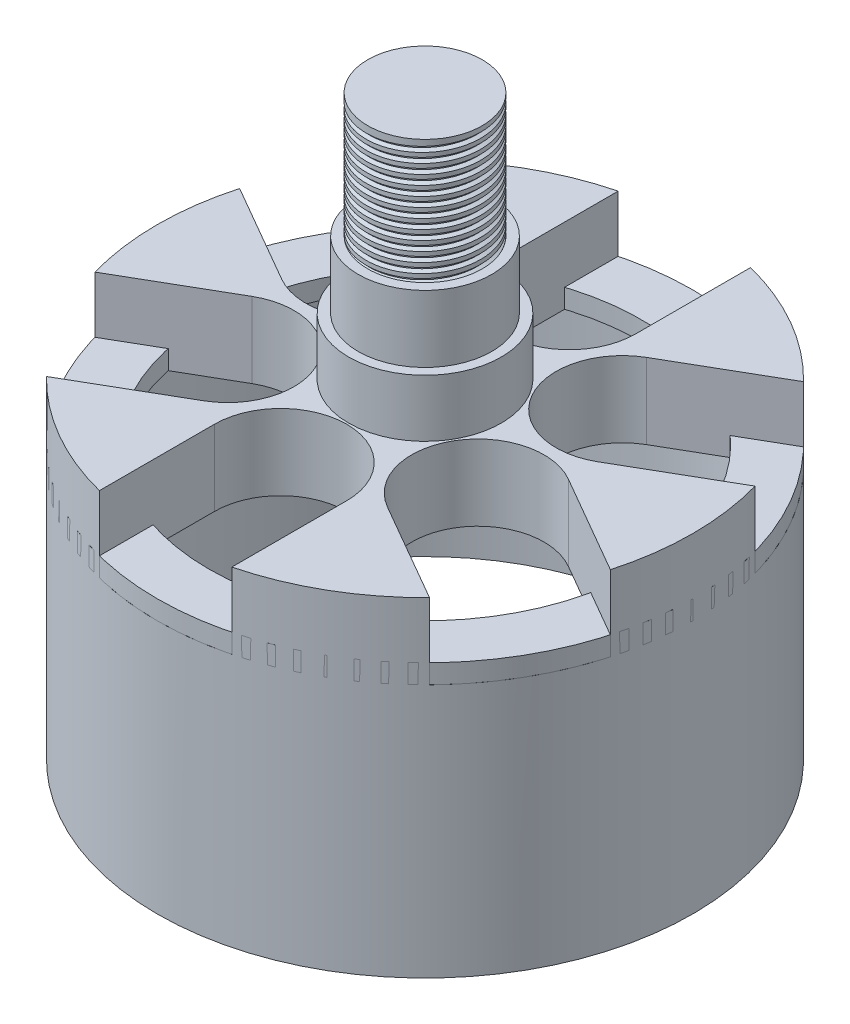
from build123d import *

# Parameters (mm, degrees)
SKETCH1_R           = 14.03
BOSS_EXTRUDE1_DEPTH = 17.27
SKETCH1_3_R         = 13.03
CUT_EXTRUDE1_DEPTH  = 13.31
CUT_EXTRUDE2_START  = -3.96
CUT_EXTRUDE2_DEPTH  = 3.96
SKETCH2_3_R         = 4
BOSS_EXTRUDE2_DEPTH = 3
SKETCH3_R           = 3.5
BOSS_EXTRUDE3_DEPTH = 3.5
SKETCH4_R           = 3
BOSS_EXTRUDE4_DEPTH = 6.5
SKETCH5_R           = 14.03
SKETCH5_R_2         = 11.33
BOSS_EXTRUDE5_DEPTH = 1
THREAD1_PITCH       = 0.5


with BuildPart() as part:
    # Sketch1 → Boss-Extrude1 (new body)
    with BuildSketch(Plane(origin=(0, 0, 0), x_dir=(1, 0, 0), z_dir=(0, 1, 0))):
        with Locations(Location((0, 0, 0), (0, 0, 270))):
            Circle(SKETCH1_R)
    extrude(amount=BOSS_EXTRUDE1_DEPTH)

    # Sketch1<3> → Cut-Extrude1 (cut)
    with BuildSketch(Plane(origin=(0, 0, 0), x_dir=(1, 0, 0), z_dir=(0, 1, 0))):
        with Locations(Location((0, 0, 0), (0, 0, 90))):
            Circle(SKETCH1_3_R)
    extrude(amount=CUT_EXTRUDE1_DEPTH, mode=Mode.SUBTRACT)

    # Sketch2 → Cut-Extrude2 (cut)
    with BuildSketch(Plane(origin=(0, 17.27, 0), x_dir=(1, 0, 0), z_dir=(0, 1, 0)).offset(CUT_EXTRUDE2_START)):
        with BuildLine():
            Line((3.47, -7.57), (3.47, -13.594116374))
            ThreePointArc((3.47, -13.594116374), (0, -14.03), (-3.47, -13.594116374))
            Line((-3.47, -13.594116374), (-3.47, -7.57))
            ThreePointArc((-3.47, -7.57), (0, -4.1), (3.47, -7.57))
        make_face()
        with BuildLine():
            Line((-8.290812307, -0.779891849), (-13.507850122, -3.791950036))
            ThreePointArc((-13.507850122, -3.791950036), (-12.150336415, -7.015), (-10.037850122, -9.802166338))
            Line((-10.037850122, -9.802166338), (-4.820812307, -6.790108151))
            ThreePointArc((-4.820812307, -6.790108151), (-3.550704156, -2.05), (-8.290812307, -0.779891849))
        make_face()
        with BuildLine():
            Line((-4.820812307, 6.790108151), (-10.037850122, 9.802166338))
            ThreePointArc((-10.037850122, 9.802166338), (-12.150336415, 7.015), (-13.507850122, 3.791950036))
            Line((-13.507850122, 3.791950036), (-8.290812307, 0.779891849))
            ThreePointArc((-8.290812307, 0.779891849), (-3.550704156, 2.05), (-4.820812307, 6.790108151))
        make_face()
        with BuildLine():
            Line((3.47, 7.57), (3.47, 13.594116374))
            ThreePointArc((3.47, 13.594116374), (0, 14.03), (-3.47, 13.594116374))
            Line((-3.47, 13.594116374), (-3.47, 7.57))
            ThreePointArc((-3.47, 7.57), (0, 4.1), (3.47, 7.57))
        make_face()
        with BuildLine():
            Line((8.290812307, 0.779891849), (13.507850122, 3.791950036))
            ThreePointArc((13.507850122, 3.791950036), (12.150336415, 7.015), (10.037850122, 9.802166338))
            Line((10.037850122, 9.802166338), (4.820812307, 6.790108151))
            ThreePointArc((4.820812307, 6.790108151), (3.550704156, 2.05), (8.290812307, 0.779891849))
        make_face()
        with BuildLine():
            Line((4.820812307, -6.790108151), (10.037850122, -9.802166338))
            ThreePointArc((10.037850122, -9.802166338), (12.150336415, -7.015), (13.507850122, -3.791950036))
            Line((13.507850122, -3.791950036), (8.290812307, -0.779891849))
            ThreePointArc((8.290812307, -0.779891849), (3.550704156, -2.05), (4.820812307, -6.790108151))
        make_face()
    extrude(amount=CUT_EXTRUDE2_DEPTH, mode=Mode.SUBTRACT)

    # Sketch2<3> → Boss-Extrude2 (add)
    with BuildSketch(Plane(origin=(0, 17.27, 0), x_dir=(1, 0, 0), z_dir=(0, 1, 0))):
        with Locations(Location((0, 0, 0), (0, 0, 270))):
            Circle(SKETCH2_3_R)
    extrude(amount=BOSS_EXTRUDE2_DEPTH)

    # Sketch3 → Boss-Extrude3 (add)
    with BuildSketch(Plane(origin=(0, 20.27, 0), x_dir=(1, 0, 0), z_dir=(0, 1, 0))):
        with Locations(Location((0, 0, 0), (0, 0, 270))):
            Circle(SKETCH3_R)
    extrude(amount=BOSS_EXTRUDE3_DEPTH)

    # Sketch4 → Boss-Extrude4 (add)
    with BuildSketch(Plane(origin=(0, 23.77, 0), x_dir=(1, 0, 0), z_dir=(0, 1, 0))):
        with Locations(Location((0, 0, 0), (0, 0, 90))):
            Circle(SKETCH4_R)
    extrude(amount=BOSS_EXTRUDE4_DEPTH)

    # Thread1: the profile of Thread Profile1 profile screwed along a right-hand helix of 13 turns, 6 arcs to a turn; built about Z, then put on its axis
    thread1_z = Axis((0, 0, 0), (0, 0, 1))
    thread1_corners = [(3.0003, 0, -0.000173205), (3.0003, 0, 0.277985704), (2.828148085, 0, 0.17859375), (2.828148085, 0, 0.09921875)]
    with BuildLine(mode=Mode.PRIVATE) as thread1_profile:
        Line(thread1_corners[0], thread1_corners[1])
        Line(thread1_corners[1], thread1_corners[2])
        Line(thread1_corners[2], thread1_corners[3])
        Line(thread1_corners[3], thread1_corners[0])
    thread1_cap = Face(thread1_profile.wire())
    thread1_turn_angles = [0, 30, 60, 90, 120, 150, 180, 210, 240, 270, 300, 330, 360]
    thread1_turn_weights = [1, 0.8660254037844387, 1, 0.8660254037844387, 1, 0.8660254037844387, 1, 0.8660254037844387, 1, 0.8660254037844387, 1, 0.8660254037844387, 1]
    thread1_turn_rails = [Edge.make_bspline([Vector(p[0], p[1], 0).rotate(thread1_z, thread1_turn_angles[k]) / thread1_turn_weights[k] + Vector(0, 0, p[2] + THREAD1_PITCH * thread1_turn_angles[k] / 360) for k in range(13)], [0, 0, 0, 1, 1, 2, 2, 3, 3, 4, 4, 5, 5, 6, 6, 6], 2, thread1_turn_weights) for p in thread1_corners]
    thread1_turn_sides = [Face.make_surface_from_curves(thread1_turn_rails[p[0]], thread1_turn_rails[p[1]]) for p in [(0, 1), (1, 2), (2, 3), (3, 0)]]
    thread1 = Plane(origin=(0, 30.27, 0), x_dir=(-1, 0, 0), z_dir=(0, -1, 0)) * Solid(Shell([*[p.moved(Location((0, 0, THREAD1_PITCH * i))) for i in range(13) for p in thread1_turn_sides], thread1_cap, thread1_cap.rotate(thread1_z, 4680).moved(Location((0, 0, THREAD1_PITCH * 4680 / 360)))]))
    add(thread1, mode=Mode.SUBTRACT)


with BuildPart() as body_2:
    # Sketch5 → Boss-Extrude5 (new body)
    with BuildSketch(Plane(origin=(0, 13.31, 0), x_dir=(1, 0, 0), z_dir=(0, 1, 0))):
        with Locations(Location((0, 0, 0), (0, 0, 270))):
            Circle(SKETCH5_R)
        with Locations(Location((0, 0, 0), (0, 0, 270))):
            Circle(SKETCH5_R_2, mode=Mode.SUBTRACT)
    extrude(amount=BOSS_EXTRUDE5_DEPTH)


solid = Compound([part.part, body_2.part])
